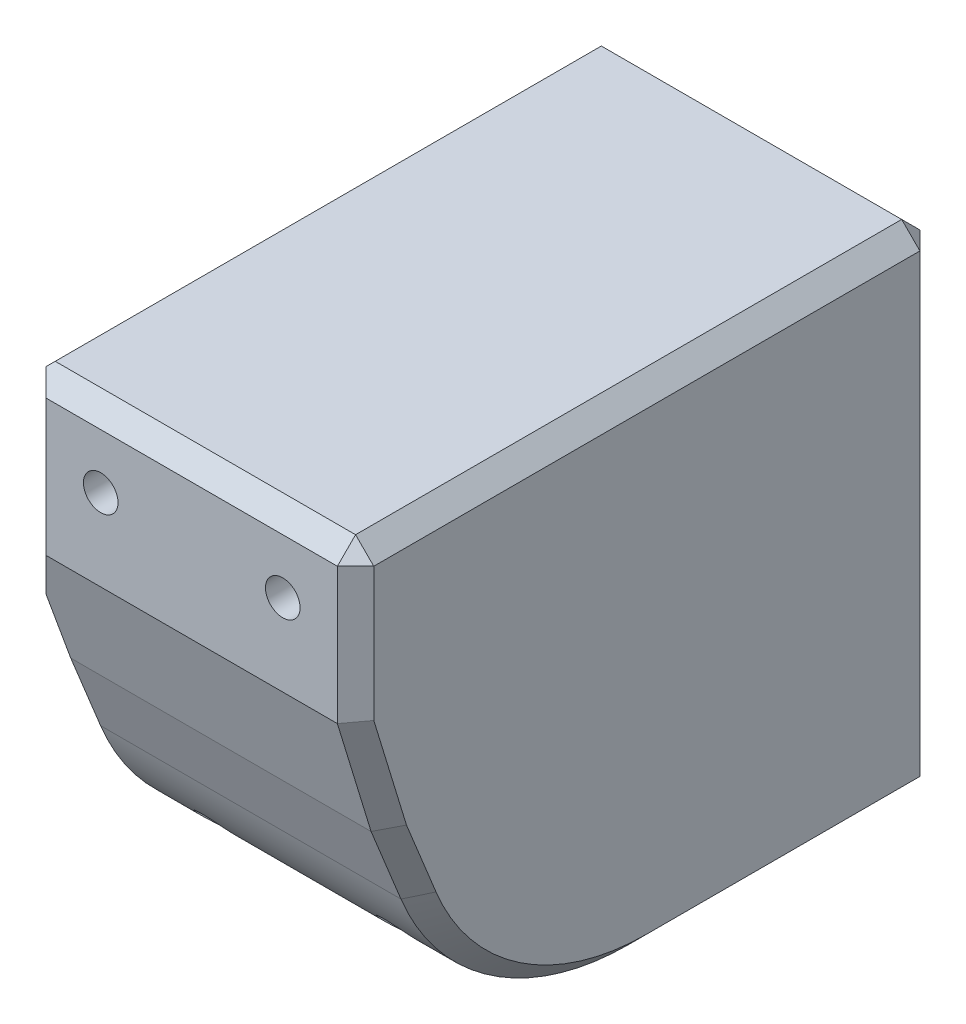
from build123d import *

# Parameters (mm, degrees)
SKETCH_1_W          = 32
SKETCH_1_H          = 27
EXTRUDE_1_DEPTH     = 18
SKETCH_2_R          = 12.5
CUT_EXTRUDE_1_DEPTH = 13.5
SKETCH_3_R          = 3.5
CUT_EXTRUDE_2_DEPTH = 4
SKETCH_4_R          = 0.95
CUT_EXTRUDE_3_DEPTH = 40.118409988
CUT_EXTRUDE_4_DEPTH = 28.608875443
CHAMFER_2_SIZE      = 1.5
CHAMFER_2_SIZE2     = 4.921659428
CHAMFER_4_SIZE      = 0.5


with BuildPart() as part:
    # 草图1 → 凸台-拉伸1 (new body)
    with BuildSketch(Plane(origin=(0, 0, 0), x_dir=(0, 0, -1), z_dir=(1, 0, 0))):
        Rectangle(SKETCH_1_W, SKETCH_1_H)
    extrude(amount=EXTRUDE_1_DEPTH)

    # 草图2 → 切除-拉伸1 (cut)
    with BuildSketch(Plane.ZY):
        Circle(SKETCH_2_R)
    extrude(amount=-CUT_EXTRUDE_1_DEPTH, mode=Mode.SUBTRACT)

    # 草图3 → 切除-拉伸2 (cut)
    with BuildSketch(Plane.ZY.offset(-13.5)):
        Circle(SKETCH_3_R)
    extrude(amount=-CUT_EXTRUDE_2_DEPTH, mode=Mode.SUBTRACT)

    # 草图4 → 切除-拉伸3 (cut, through all)
    with BuildSketch(Plane(origin=(0, 0, -16), x_dir=(-1, 0, 0), z_dir=(0, 0, -1))):
        with Locations((-14, 9.5)):
            Circle(SKETCH_4_R)
        with Locations((-4, 9.5)):
            Circle(SKETCH_4_R)
        with Locations((-4, -9.5)):
            Circle(SKETCH_4_R)
        with Locations(Location((-14, -9.5, 0), (0, 0, 180))):
            Circle(SKETCH_4_R)
    extrude(amount=-CUT_EXTRUDE_3_DEPTH, mode=Mode.SUBTRACT)

    # 草图6 → 切除-拉伸4 (cut, through all)
    with BuildSketch(Plane.ZY):
        with BuildLine():
            Line((16, -13.5), (16, 3.515112589))
            Line((16, 3.515112589), (12.507048233, -5.08170685))
            ThreePointArc((12.507048233, -5.08170685), (7.538134966, -11.199398253), (0, -13.5))
            Line((0, -13.5), (16, -13.5))
        make_face()
    extrude(amount=-CUT_EXTRUDE_4_DEPTH, mode=Mode.SUBTRACT)

    # 倒角2
    chamfer_2_edges = [part.edges().sort_by_distance(p)[0] for p in [
        (9, 3.515112589, 16),
    ]]
    chamfer_2_side = [part.faces().sort_by_distance(p)[0] for p in [
        (9, 8.475223706, 16),
    ]]
    chamfer(chamfer_2_edges, length=CHAMFER_2_SIZE, length2=CHAMFER_2_SIZE2, reference=chamfer_2_side[0])

    # 倒角3
    # the kernel refuses this chamfer: 1 mm, written as the material it takes off along each edge
    with BuildSketch(Plane(origin=(17.333333333, 12.833333333, 15.333333333), x_dir=(-0.7071067811865475, 0, 0.7071067811865475), z_dir=(0.5773502691896258, 0.5773502691896258, 0.5773502691896258)), Plane(origin=(17.333333333, 12.833333333, -15.333333333), x_dir=(-0.7071067811865475, 0.7071067811865475, 0), z_dir=(0.5773502691896258, 0.5773502691896258, -0.5773502691896258))) as chamfer_3_piece_1:
        Polygon((-0.707106781, 0.40824829), (0.707106781, 0.40824829), (0, -0.816496581), align=None)
    extrude(amount=1.270170592, mode=Mode.SUBTRACT)
    with BuildSketch(Plane(origin=(17.333333333, -12.833333333, -15.333333333), x_dir=(-0.7071067811865475, -0.7071067811865475, 0), z_dir=(0.5773502691896258, -0.5773502691896258, -0.5773502691896258))) as chamfer_3_piece_2:
        Polygon((-0.707106781, -0.40824829), (0.707106781, -0.40824829), (0, 0.816496581), align=None)
    extrude(amount=1.270170592, mode=Mode.SUBTRACT)
    with BuildSketch(Plane(origin=(18, 16.071682988, 16), x_dir=(-1, 0, 0), z_dir=(0, -1, 0)), Plane(origin=(0, 16.071682988, 16), x_dir=(0, 0, -1), z_dir=(0, -1, 0))) as chamfer_3_piece_3:
        with BuildLine():
            Line((1.028284271, -0.028284271), (-0.028284271, 1.028284271))
            Line((-0.028284271, 1.028284271), (-0.048284271, 1.028284271))
            ThreePointArc((-0.048284271, 1.028284271), (-0.02, 0.514142136), (-0.02, 0))
            Line((-0.02, 0), (0, -0.02))
            ThreePointArc((0, -0.02), (0.514142136, -0.02), (1.028284271, -0.048284271))
            Line((1.028284271, -0.048284271), (1.028284271, -0.028284271))
        make_face()
    extrude(amount=15.428431478, mode=Mode.SUBTRACT)
    with BuildSketch(Plane(origin=(18, -16.071682988, -16), x_dir=(-1, 0, 0), z_dir=(0, 1, 0)), Plane(origin=(0, -16.071682988, -16), x_dir=(0, 0, 1), z_dir=(0, 1, 0))) as chamfer_3_piece_4:
        with BuildLine():
            Line((1.028284271, -0.028284271), (-0.028284271, 1.028284271))
            Line((-0.028284271, 1.028284271), (-0.048284271, 1.028284271))
            ThreePointArc((-0.048284271, 1.028284271), (-0.02, 0.514142136), (-0.02, 0))
            Line((-0.02, 0), (0, -0.02))
            ThreePointArc((0, -0.02), (0.514142136, -0.02), (1.028284271, -0.048284271))
            Line((1.028284271, -0.048284271), (1.028284271, -0.028284271))
        make_face()
    extrude(amount=32.143365976, mode=Mode.SUBTRACT)
    with BuildSketch(Plane(origin=(18, -13.5, 0), x_dir=(-1, 0, 0), z_dir=(0, 0, -1))) as chamfer_3_piece_5:
        with BuildLine():
            Line((1.028284271, -0.028284271), (-0.028284271, 1.028284271))
            Line((-0.028284271, 1.028284271), (-0.048284271, 1.028284271))
            ThreePointArc((-0.048284271, 1.028284271), (-0.02, 0.514142136), (-0.02, 0))
            Line((-0.02, 0), (0, -0.02))
            ThreePointArc((0, -0.02), (0.514142136, -0.02), (1.028284271, -0.048284271))
            Line((1.028284271, -0.048284271), (1.028284271, -0.028284271))
        make_face()
    extrude(amount=18.571682988, mode=Mode.SUBTRACT)
    with BuildSketch(Plane(origin=(18, 0, 0), x_dir=(0, -1, 0), z_dir=(0, 0, -1))) as chamfer_3_piece_6:
        with BuildLine():
            Line((13.528284271, 1.028284271), (12.471715729, -0.028284271))
            Line((12.471715729, -0.028284271), (12.471715729, -0.048284271))
            ThreePointArc((12.471715729, -0.048284271), (12.985857864, -0.02), (13.5, -0.02))
            Line((13.5, -0.02), (13.52, 0))
            ThreePointArc((13.52, 0), (13.52, 0.514142136), (13.548284271, 1.028284271))
            Line((13.548284271, 1.028284271), (13.528284271, 1.028284271))
        make_face()
    revolve(axis=Axis((18, 0, 0), (-1, 0, 0)), revolution_arc=67.887726461, mode=Mode.SUBTRACT)
    with BuildSketch(Plane(origin=(18, -5.08170685, 12.507048233), x_dir=(-1, 0, 0), z_dir=(0, 0.9264480172326814, 0.3764227296081273))) as chamfer_3_piece_7:
        with BuildLine():
            Line((1.028284271, 0.028284271), (-0.028284271, -1.028284271))
            Line((-0.028284271, -1.028284271), (-0.048284271, -1.028284271))
            ThreePointArc((-0.048284271, -1.028284271), (-0.02, -0.514142136), (-0.02, 0))
            Line((-0.02, 0), (0, 0.02))
            ThreePointArc((0, 0.02), (0.514142136, 0.02), (1.028284271, 0.048284271))
            Line((1.028284271, 0.048284271), (1.028284271, 0.028284271))
        make_face()
    extrude(amount=17.216088275, mode=Mode.SUBTRACT)
    with BuildSketch(Plane(origin=(18, 9.195944132, 17.278208477), x_dir=(-1, 0, 0), z_dir=(0, -0.9563047559630353, -0.2923717047227372))) as chamfer_3_piece_8:
        with BuildLine():
            Line((1.028284271, -0.028284271), (-0.028284271, 1.028284271))
            Line((-0.028284271, 1.028284271), (-0.048284271, 1.028284271))
            ThreePointArc((-0.048284271, 1.028284271), (-0.02, 0.514142136), (-0.02, 0))
            Line((-0.02, 0), (0, -0.02))
            ThreePointArc((0, -0.02), (0.514142136, -0.02), (1.028284271, -0.048284271))
            Line((1.028284271, -0.048284271), (1.028284271, -0.028284271))
        make_face()
    extrude(amount=23.566814221, mode=Mode.SUBTRACT)
    with BuildSketch(Plane(origin=(-2.571682988, -13.5, -16), x_dir=(0, 0, 1), z_dir=(1, 0, 0))) as chamfer_3_piece_9:
        with BuildLine():
            Line((1.028284271, 0.028284271), (-0.028284271, -1.028284271))
            Line((-0.028284271, -1.028284271), (-0.048284271, -1.028284271))
            ThreePointArc((-0.048284271, -1.028284271), (-0.02, -0.514142136), (-0.02, 0))
            Line((-0.02, 0), (0, 0.02))
            ThreePointArc((0, 0.02), (0.514142136, 0.02), (1.028284271, 0.048284271))
            Line((1.028284271, 0.048284271), (1.028284271, 0.028284271))
        make_face()
    extrude(amount=23.143365976, mode=Mode.SUBTRACT)
    with BuildSketch(Plane(origin=(-2.571682988, 13.5, 16), x_dir=(0, -1, 0), z_dir=(1, 0, 0)), Plane(origin=(-2.571682988, 13.5, -16), x_dir=(0, 0, 1), z_dir=(1, 0, 0))) as chamfer_3_piece_10:
        with BuildLine():
            Line((1.028284271, -0.028284271), (-0.028284271, 1.028284271))
            Line((-0.028284271, 1.028284271), (-0.048284271, 1.028284271))
            ThreePointArc((-0.048284271, 1.028284271), (-0.02, 0.514142136), (-0.02, 0))
            Line((-0.02, 0), (0, -0.02))
            ThreePointArc((0, -0.02), (0.514142136, -0.02), (1.028284271, -0.048284271))
            Line((1.028284271, -0.048284271), (1.028284271, -0.028284271))
        make_face()
    extrude(amount=23.143365976, mode=Mode.SUBTRACT)
    with BuildSketch(Plane(origin=(18, 13.5, -18.571682988), x_dir=(-1, 0, 0), z_dir=(0, 0, 1))) as chamfer_3_piece_11:
        with BuildLine():
            Line((1.028284271, -0.028284271), (-0.028284271, 1.028284271))
            Line((-0.028284271, 1.028284271), (-0.048284271, 1.028284271))
            ThreePointArc((-0.048284271, 1.028284271), (-0.02, 0.514142136), (-0.02, 0))
            Line((-0.02, 0), (0, -0.02))
            ThreePointArc((0, -0.02), (0.514142136, -0.02), (1.028284271, -0.048284271))
            Line((1.028284271, -0.048284271), (1.028284271, -0.028284271))
        make_face()
    extrude(amount=37.143365976, mode=Mode.SUBTRACT)

    # 倒角4
    # the kernel refuses this chamfer: 0.5 mm, written as the material it takes off along each edge
    with BuildSketch(Plane(origin=(0, 13.5, -16.285841494), x_dir=(0, -1, 0), z_dir=(0, 0, 1))) as chamfer_4_piece_1:
        Polygon((CHAMFER_4_SIZE, 0), (0, CHAMFER_4_SIZE), (0, 0), align=None)
    extrude(amount=32.571682988, mode=Mode.SUBTRACT)
    with BuildSketch(Plane(origin=(0, 4.911777484, 16.567475349), x_dir=(0, 0.3764227296081273, -0.9264480172326813), z_dir=(0, -0.9264480172326814, -0.3764227296081273))) as chamfer_4_piece_2:
        Polygon((CHAMFER_4_SIZE, 0), (0, CHAMFER_4_SIZE), (0, 0), align=None)
    extrude(amount=10.786880805, mode=Mode.SUBTRACT)
    with BuildSketch(Plane(origin=(0, 0, 0), x_dir=(0, -0.3764227296081274, 0.9264480172326813), z_dir=(0, 0.9264480172326813, 0.3764227296081274))) as chamfer_4_piece_3:
        Polygon((13.5 - CHAMFER_4_SIZE, 0), (13.5, CHAMFER_4_SIZE), (13.5, 0), align=None)
    revolve(axis=Axis((0, 0, 0), (1, 0, 0)), revolution_arc=67.887726461, mode=Mode.SUBTRACT)
    with BuildSketch(Plane(origin=(0, -13.5, 0), x_dir=(0, 1, 0), z_dir=(0, 0, -1))) as chamfer_4_piece_4:
        Polygon((CHAMFER_4_SIZE, 0), (0, CHAMFER_4_SIZE), (0, 0), align=None)
    extrude(amount=16.285841494, mode=Mode.SUBTRACT)
    with BuildSketch(Plane(origin=(0, 0, 0), x_dir=(0, 0, 1), z_dir=(0, -1, 0))) as chamfer_4_piece_5:
        Polygon((12.5 + CHAMFER_4_SIZE, 0), (12.5, -CHAMFER_4_SIZE), (12.5, 0), align=None)
    revolve(axis=Axis((0, 0, 0), (-1, 0, 0)), mode=Mode.SUBTRACT)
    with BuildSketch(Plane(origin=(13.5, 0, 0), x_dir=(0, 0, 1), z_dir=(0, -1, 0))) as chamfer_4_piece_6:
        Polygon((3.5 + CHAMFER_4_SIZE, 0), (3.5, -CHAMFER_4_SIZE), (3.5, 0), align=None)
    revolve(axis=Axis((13.5, 0, 0), (-1, 0, 0)), mode=Mode.SUBTRACT)


solid = part.part
